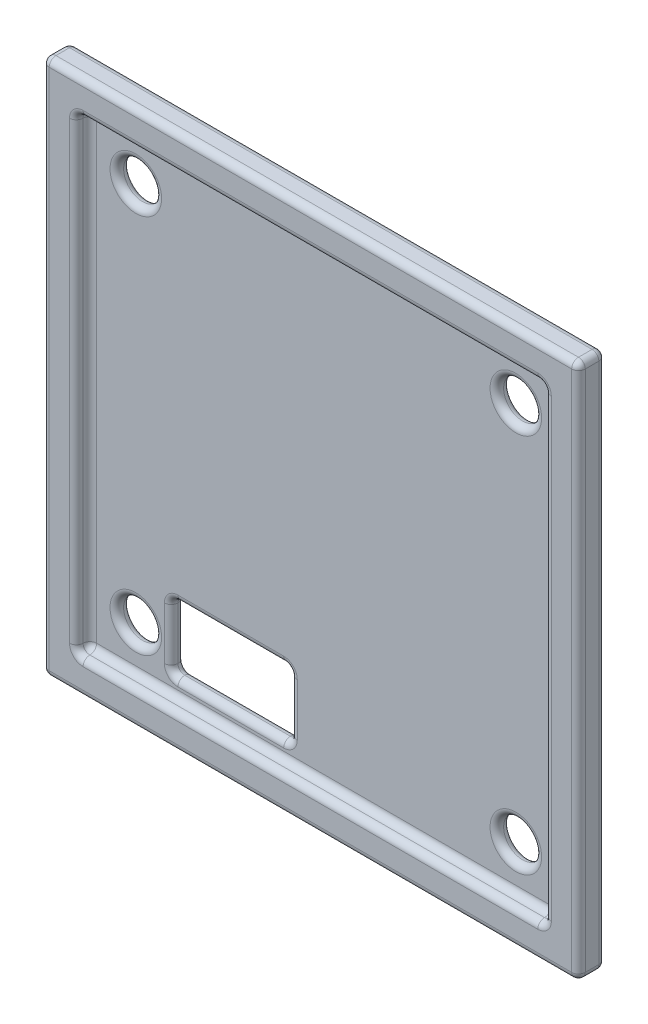
from build123d import *

# Parameters (mm, degrees)
SKETCH1_W           = 39.5
SKETCH1_H           = 39.5
BOSS_EXTRUDE1_DEPTH = 1
SKETCH2_W           = 39.5
SKETCH2_H           = 39.5
SKETCH2_W_2         = 34.5
SKETCH2_H_2         = 34.5
BOSS_EXTRUDE2_DEPTH = 1
SKETCH3_R           = 1.4
SKETCH3_W           = 8.791701937
SKETCH3_H           = 4.864714439
CUT_EXTRUDE1_DEPTH  = 2
FILLET1_R           = 0.5


with BuildPart() as part:
    # Sketch1 → Boss-Extrude1 (new body)
    with BuildSketch(Plane.XY):
        Rectangle(SKETCH1_W, SKETCH1_H)
    extrude(amount=BOSS_EXTRUDE1_DEPTH)

    # Sketch2 → Boss-Extrude2 (add)
    with BuildSketch(Plane.XY.offset(1)):
        Rectangle(SKETCH2_W, SKETCH2_H)
        Rectangle(SKETCH2_W_2, SKETCH2_H_2, mode=Mode.SUBTRACT)
    extrude(amount=BOSS_EXTRUDE2_DEPTH)

    # Sketch3 → Cut-Extrude1 (cut)
    with BuildSketch(Plane(origin=(0, 0, 0), x_dir=(-1, 0, 0), z_dir=(0, 0, -1))):
        with Locations((-14.134608342, 14.019805901)):
            Circle(SKETCH3_R)
        with Locations((13.865391658, 14.019805901)):
            Circle(SKETCH3_R)
        with Locations((13.865391658, -13.980194099)):
            Circle(SKETCH3_R)
        with Locations((-14.134608342, -13.980194099)):
            Circle(SKETCH3_R)
        with Locations((6.865164106, -13.612828624)):
            Rectangle(SKETCH3_W, SKETCH3_H)
    extrude(amount=-CUT_EXTRUDE1_DEPTH, mode=Mode.SUBTRACT)

    # Fillet1
    fillet1_edges = [part.edges().sort_by_distance(p)[0] for p in [
        (-19.75, 0, 2),
        (0, -19.75, 2),
        (19.75, 0, 2),
        (0, 19.75, 2),
        (-17.25, 0, 1),
        (0, -17.25, 1),
        (17.25, 0, 1),
        (0, 17.25, 1),
        (-17.25, 0, 2),
        (-17.25, -17.25, 1.5),
        (0, -17.25, 2),
        (17.25, -17.25, 1.5),
        (17.25, 0, 2),
        (17.25, 17.25, 1.5),
        (0, 17.25, 2),
        (-17.25, 17.25, 1.5),
        (-6.865164105, -16.045185843, 1),
        (-11.261015074, -13.612828624, 1),
        (-6.865164105, -11.180471404, 1),
        (-2.469313137, -13.612828624, 1),
        (15.534608342, -13.980194099, 1),
        (15.534608342, -13.980194099, 0),
        (0, -19.75, 0),
        (-12.465391658, -13.980194099, 1),
        (-12.465391658, -13.980194099, 0),
        (-12.465391658, 14.019805901, 1),
        (-12.465391658, 14.019805901, 0),
        (-19.75, 0, 0),
        (15.534608342, 14.019805901, 1),
        (15.534608342, 14.019805901, 0),
        (0, 19.75, 0),
        (-2.469313137, -16.045185843, 0.5),
        (-2.469313137, -11.180471404, 0.5),
        (-11.261015074, -11.180471404, 0.5),
        (-11.261015074, -16.045185843, 0.5),
        (-2.469313137, -13.612828624, 0),
        (-6.865164105, -16.045185843, 0),
        (-11.261015074, -13.612828624, 0),
        (-6.865164105, -11.180471404, 0),
        (19.75, 0, 0),
        (19.75, -19.75, 1),
        (-19.75, -19.75, 1),
        (-19.75, 19.75, 1),
        (19.75, 19.75, 1),
    ]]
    fillet(fillet1_edges, radius=FILLET1_R - 0.0001)  # a hair under: the kernel refuses the full size


solid = part.part
